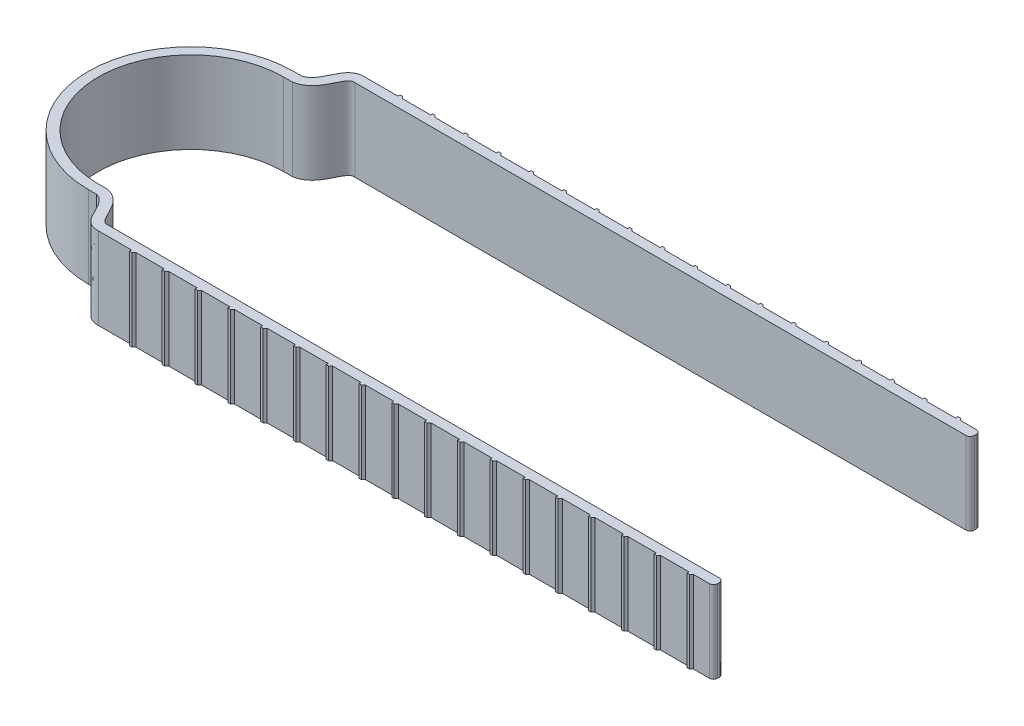
from build123d import *

# Parameters (mm, degrees)
BOSS_EXTRUDE1_DEPTH = 20


with BuildPart() as part:
    # Sketch1 → Boss-Extrude1 (new body)
    with BuildSketch(Plane(origin=(0, 0, 0), x_dir=(1, 0, 0), z_dir=(0, 1, 0))):
        with BuildLine():
            Line((0, -25), (1.927350057, -24.998612156))
            add(Edge.make_bspline(
                [(1.927350057, -24.998612156), (2.68006028, -25.175805243), (4.61926121, -26.527454342), (5.842081607, -30.812114485), (8.257321632, -32.589557235), (9.997702256, -32.5)],
                knots=[0.122516909, 0.122516909, 0.122516909, 0.122516909, 0.292834345, 0.695813035, 1, 1, 1, 1], degree=3))
            Line((9.997702256, -32.5), (17.997702256, -32.5))
            Line((17.997702256, -32.5), (17.997702256, -33))
            Line((17.997702256, -33), (18.59572115, -33))
            Line((18.59572115, -33), (19.09572115, -32.5))
            Line((19.09572115, -32.5), (25.997702256, -32.5))
            Line((25.997702256, -32.5), (25.997702256, -33))
            Line((25.997702256, -33), (26.59572115, -33))
            Line((26.59572115, -33), (27.09572115, -32.5))
            Line((27.09572115, -32.5), (33.997702256, -32.5))
            Line((33.997702256, -32.5), (33.997702256, -33))
            Line((33.997702256, -33), (34.59572115, -33))
            Line((34.59572115, -33), (35.09572115, -32.5))
            Line((35.09572115, -32.5), (41.997702256, -32.5))
            Line((41.997702256, -32.5), (41.997702256, -33))
            Line((41.997702256, -33), (42.59572115, -33))
            Line((42.59572115, -33), (43.09572115, -32.5))
            Line((43.09572115, -32.5), (49.997702256, -32.5))
            Line((49.997702256, -32.5), (49.997702256, -33))
            Line((49.997702256, -33), (50.59572115, -33))
            Line((50.59572115, -33), (51.09572115, -32.5))
            Line((51.09572115, -32.5), (57.997702256, -32.5))
            Line((57.997702256, -32.5), (57.997702256, -33))
            Line((57.997702256, -33), (58.59572115, -33))
            Line((58.59572115, -33), (59.09572115, -32.5))
            Line((59.09572115, -32.5), (65.997702256, -32.5))
            Line((65.997702256, -32.5), (65.997702256, -33))
            Line((65.997702256, -33), (66.59572115, -33))
            Line((66.59572115, -33), (67.09572115, -32.5))
            Line((67.09572115, -32.5), (73.997702256, -32.5))
            Line((73.997702256, -32.5), (73.997702256, -33))
            Line((73.997702256, -33), (74.59572115, -33))
            Line((74.59572115, -33), (75.09572115, -32.5))
            Line((75.09572115, -32.5), (81.997702256, -32.5))
            Line((81.997702256, -32.5), (81.997702256, -33))
            Line((81.997702256, -33), (82.59572115, -33))
            Line((82.59572115, -33), (83.09572115, -32.5))
            Line((83.09572115, -32.5), (89.997702256, -32.5))
            Line((89.997702256, -32.5), (89.997702256, -33))
            Line((89.997702256, -33), (90.59572115, -33))
            Line((90.59572115, -33), (91.09572115, -32.5))
            Line((91.09572115, -32.5), (97.997702256, -32.5))
            Line((97.997702256, -32.5), (97.997702256, -33))
            Line((97.997702256, -33), (98.59572115, -33))
            Line((98.59572115, -33), (99.09572115, -32.5))
            Line((99.09572115, -32.5), (105.997702256, -32.5))
            Line((105.997702256, -32.5), (105.997702256, -33))
            Line((105.997702256, -33), (106.59572115, -33))
            Line((106.59572115, -33), (107.09572115, -32.5))
            Line((107.09572115, -32.5), (113.997702256, -32.5))
            Line((113.997702256, -32.5), (113.997702256, -33))
            Line((113.997702256, -33), (114.59572115, -33))
            Line((114.59572115, -33), (115.09572115, -32.5))
            Line((115.09572115, -32.5), (121.997702256, -32.5))
            Line((121.997702256, -32.5), (121.997702256, -33))
            Line((121.997702256, -33), (122.59572115, -33))
            Line((122.59572115, -33), (123.09572115, -32.5))
            Line((123.09572115, -32.5), (129.997702256, -32.5))
            Line((129.997702256, -32.5), (129.997702256, -33))
            Line((129.997702256, -33), (130.59572115, -33))
            Line((130.59572115, -33), (131.09572115, -32.5))
            Line((131.09572115, -32.5), (137.997702256, -32.5))
            Line((137.997702256, -32.5), (137.997702256, -33))
            Line((137.997702256, -33), (138.59572115, -33))
            Line((138.59572115, -33), (139.09572115, -32.5))
            Line((139.09572115, -32.5), (145.997702256, -32.5))
            Line((145.997702256, -32.5), (145.997702256, -33))
            Line((145.997702256, -33), (146.59572115, -33))
            Line((146.59572115, -33), (147.09572115, -32.5))
            Line((147.09572115, -32.5), (153.997702256, -32.5))
            Line((153.997702256, -32.5), (153.997702256, -33))
            Line((153.997702256, -33), (154.59572115, -33))
            Line((154.59572115, -33), (155.09572115, -32.5))
            Line((155.09572115, -32.5), (158.997702256, -32.5))
            ThreePointArc((158.997702256, -32.5), (159.704809037, -32.207106781), (159.997702256, -31.5))
            Line((159.997702256, -31.5), (159.997702256, -31.1))
            ThreePointArc((159.997702256, -31.1), (159.704809037, -30.392893219), (158.997702256, -30.1))
            Line((158.997702256, -30.1), (9.935992978, -30.1))
            add(Edge.make_bspline(
                [(2.205176917, -22.598411476), (2.267435831, -22.613067647), (2.366992365, -22.636788272), (2.475061759, -22.661470293), (2.709917754, -22.7199272), (2.954572165, -22.793775854), (3.359005607, -22.938739367), (3.830920698, -23.156142652), (4.52645897, -23.573105061), (5.261326576, -24.189892196), (6.173853599, -25.260480295), (6.951117716, -26.609738565), (7.640857914, -28.063369321), (8.252378601, -29.207955655), (8.698157195, -29.741351106), (8.966687806, -29.939190657), (9.156598701, -30.030612029), (9.377464435, -30.087812361), (9.61517964, -30.106707611), (9.750493555, -30.107675026), (9.833580745, -30.105109465), (9.867815132, -30.103540426), (9.915842911, -30.101036891), (9.935992978, -30.1)],
                knots=[0.10199274, 0.10199274, 0.10199274, 0.10199274, 0.116080205, 0.123123937, 0.130167669, 0.144255134, 0.158342598, 0.186517527, 0.214692456, 0.271042315, 0.327392173, 0.440091889, 0.552791605, 0.665491321, 0.778191038, 0.834540896, 0.890890754, 0.947240612, 0.975415541, 0.989503006, 0.996546738, 1.000068604, 1.00359047, 1.00359047, 1.00359047, 1.00359047], degree=3))
            Line((2.205176917, -22.598411476), (-0.000864094, -22.600000311))
            ThreePointArc((-0.000864094, -22.600000311), (-15.980918755, -15.980307748), (-22.6, 0))
            ThreePointArc((-22.6, 0), (-15.980613252, 15.980613258), (8e-09, 22.6))
            Line((8e-09, 22.6), (2.218978524, 22.6))
            add(Edge.make_bspline(
                [(2.218978524, 22.6), (2.281300782, 22.614671082), (2.385564969, 22.639433813), (2.481460684, 22.661426356), (2.721100403, 22.720167002), (2.970178237, 22.794575525), (3.382639147, 22.940907547), (3.864177952, 23.16092986), (4.574270281, 23.58382191), (5.323974278, 24.210279474), (6.251734968, 25.295893092), (7.03699547, 26.657862338), (7.729139549, 28.115737463), (8.337723473, 29.254262491), (8.771727327, 29.771295755), (9.019922269, 29.953200839), (9.19015975, 30.035202168), (9.394632769, 30.088580701), (9.621706674, 30.10671539), (9.753143024, 30.107596382), (9.83307201, 30.105135973), (9.867716353, 30.103525978), (9.915797337, 30.101034818), (9.935992978, 30.100000008)],
                knots=[0.101204543, 0.101204543, 0.101204543, 0.101204543, 0.115306341, 0.122357239, 0.129408138, 0.143509936, 0.157611733, 0.185815328, 0.214018923, 0.270426113, 0.326833303, 0.439647683, 0.552462064, 0.665276444, 0.778090824, 0.834498014, 0.890905204, 0.947312394, 0.975515989, 0.989617787, 0.996668685, 1.000194135, 1.003719584, 1.003719584, 1.003719584, 1.003719584], degree=3))
            Line((9.935992978, 30.100000008), (159.000000085, 30.100000008))
            ThreePointArc((159.000000085, 30.100000008), (159.707106866, 30.392893227), (160.000000085, 31.100000008))
            Line((160.000000085, 31.100000008), (160.000000085, 31.600000008))
            ThreePointArc((160.000000085, 31.600000008), (159.707106866, 32.307106789), (159.000000085, 32.600000008))
            Line((159.000000085, 32.600000008), (155.098018978, 32.600000008))
            Line((155.098018978, 32.600000008), (154.598018978, 33.100000008))
            Line((154.598018978, 33.100000008), (154.000000085, 33.100000008))
            Line((154.000000085, 33.100000008), (154.000000085, 32.5))
            Line((154.000000085, 32.5), (147.098018978, 32.5))
            Line((147.098018978, 32.5), (146.598018978, 33))
            Line((146.598018978, 33), (146.000000085, 33))
            Line((146.000000085, 33), (146.000000085, 32.5))
            Line((146.000000085, 32.5), (139.098018978, 32.5))
            Line((139.098018978, 32.5), (138.598018978, 33))
            Line((138.598018978, 33), (138.000000085, 33))
            Line((138.000000085, 33), (138.000000085, 32.5))
            Line((138.000000085, 32.5), (131.098018978, 32.5))
            Line((131.098018978, 32.5), (130.598018978, 33))
            Line((130.598018978, 33), (130.000000085, 33))
            Line((130.000000085, 33), (130.000000085, 32.5))
            Line((130.000000085, 32.5), (123.098018978, 32.5))
            Line((123.098018978, 32.5), (122.598018978, 33))
            Line((122.598018978, 33), (122.000000085, 33))
            Line((122.000000085, 33), (122.000000085, 32.5))
            Line((122.000000085, 32.5), (115.098018978, 32.5))
            Line((115.098018978, 32.5), (114.598018978, 33))
            Line((114.598018978, 33), (114.000000085, 33))
            Line((114.000000085, 33), (114.000000085, 32.5))
            Line((114.000000085, 32.5), (107.098018978, 32.5))
            Line((107.098018978, 32.5), (106.598018978, 33))
            Line((106.598018978, 33), (106.000000085, 33))
            Line((106.000000085, 33), (106.000000085, 32.5))
            Line((106.000000085, 32.5), (99.098018978, 32.5))
            Line((99.098018978, 32.5), (98.598018978, 33))
            Line((98.598018978, 33), (98.000000085, 33))
            Line((98.000000085, 33), (98.000000085, 32.5))
            Line((98.000000085, 32.5), (91.098018978, 32.5))
            Line((91.098018978, 32.5), (90.598018978, 33))
            Line((90.598018978, 33), (90.000000085, 33))
            Line((90.000000085, 33), (90.000000085, 32.5))
            Line((90.000000085, 32.5), (83.098018978, 32.5))
            Line((83.098018978, 32.5), (82.598018978, 33))
            Line((82.598018978, 33), (82.000000085, 33))
            Line((82.000000085, 33), (82.000000085, 32.5))
            Line((82.000000085, 32.5), (75.098018978, 32.5))
            Line((75.098018978, 32.5), (74.598018978, 33))
            Line((74.598018978, 33), (74.000000085, 33))
            Line((74.000000085, 33), (74.000000085, 32.5))
            Line((74.000000085, 32.5), (67.098018978, 32.5))
            Line((67.098018978, 32.5), (66.598018978, 33))
            Line((66.598018978, 33), (66.000000085, 33))
            Line((66.000000085, 33), (66.000000085, 32.5))
            Line((66.000000085, 32.5), (59.098018978, 32.5))
            Line((59.098018978, 32.5), (58.598018978, 33))
            Line((58.598018978, 33), (58.000000085, 33))
            Line((58.000000085, 33), (58.000000085, 32.5))
            Line((58.000000085, 32.5), (51.098018978, 32.5))
            Line((51.098018978, 32.5), (50.598018978, 33))
            Line((50.598018978, 33), (50.000000085, 33))
            Line((50.000000085, 33), (50.000000085, 32.5))
            Line((50.000000085, 32.5), (43.098018978, 32.5))
            Line((43.098018978, 32.5), (42.598018978, 33))
            Line((42.598018978, 33), (42.000000085, 33))
            Line((42.000000085, 33), (42.000000085, 32.5))
            Line((42.000000085, 32.5), (35.098018978, 32.5))
            Line((35.098018978, 32.5), (34.598018978, 33))
            Line((34.598018978, 33), (34.000000085, 33))
            Line((34.000000085, 33), (34.000000085, 32.5))
            Line((34.000000085, 32.5), (27.098018978, 32.5))
            Line((27.098018978, 32.5), (26.598018978, 33))
            Line((26.598018978, 33), (26.000000085, 33))
            Line((26.000000085, 33), (26.000000085, 32.5))
            Line((26.000000085, 32.5), (19.098018978, 32.5))
            Line((19.098018978, 32.5), (18.598018978, 33))
            Line((18.598018978, 33), (18.000000085, 33))
            Line((18.000000085, 33), (18.000000085, 32.5))
            Line((18.000000085, 32.5), (10.000000085, 32.5))
            add(Edge.make_bspline(
                [(1.928687549, 24.999999993), (2.681397772, 25.177193081), (4.61759437, 26.525850526), (5.843578454, 30.812690035), (8.257456222, 32.589286681), (10.000000085, 32.5)],
                knots=[0.122516909, 0.122516909, 0.122516909, 0.122516909, 0.292834345, 0.695813035, 1, 1, 1, 1], degree=3))
            Line((1.928687549, 24.999999993), (0, 25))
            ThreePointArc((0, 25), (-17.67766953, 17.67766953), (-25, 0))
            ThreePointArc((-25, 0), (-17.67766953, -17.67766953), (0, -25))
        make_face()
    extrude(amount=BOSS_EXTRUDE1_DEPTH)


solid = part.part
